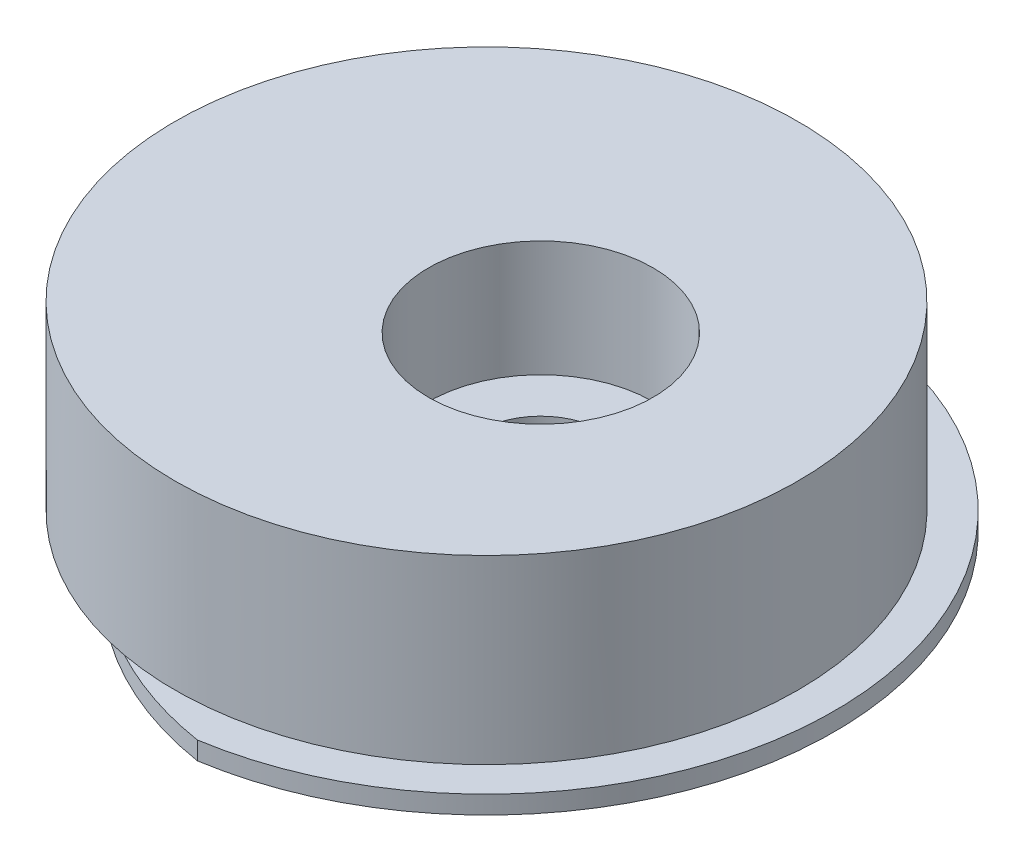
from build123d import *

# Parameters (mm, degrees)
BOSS_EXTRUDE1_DEPTH = 0.5
SKETCH2_R           = 8.6
BOSS_EXTRUDE2_DEPTH = 5
SKETCH3_R           = 1.65
SKETCH3_R_2         = 1.35
CUT_EXTRUDE1_DEPTH  = 4
SKETCH4_R           = 1.7
CUT_EXTRUDE2_DEPTH  = 15.90536816
SKETCH5_R           = 3.1
CUT_EXTRUDE3_DEPTH  = 3.2


with BuildPart() as part:
    # Sketch1 → Boss-Extrude1 (new body)
    with BuildSketch(Plane(origin=(0, 0, 0), x_dir=(1, 0, 0), z_dir=(0, 1, 0))):
        with BuildLine():
            ThreePointArc((8.1, 0), (5.799315036, 6.235382907), (0, 9.482088378))
            ThreePointArc((0, 9.482088378), (-8.1, 0), (0, -9.482088378))
            ThreePointArc((0, -9.482088378), (5.799315036, -6.235382907), (8.1, 0))
        make_face()
    extrude(amount=BOSS_EXTRUDE1_DEPTH)

    # Sketch2 → Boss-Extrude2 (add)
    with BuildSketch(Plane(origin=(0, 0.5, 0), x_dir=(1, 0, 0), z_dir=(0, 1, 0))):
        with Locations((-1.5, 0)):
            Circle(SKETCH2_R)
    extrude(amount=BOSS_EXTRUDE2_DEPTH)

    # Sketch3 → Cut-Extrude1 (cut)
    with BuildSketch(Plane(origin=(0, 0, 0), x_dir=(1, 0, 0), z_dir=(0, 1, 0))):
        with Locations((0, 5.8)):
            Circle(SKETCH3_R)
        with Locations((0, -5.8)):
            Circle(SKETCH3_R_2)
    extrude(amount=CUT_EXTRUDE1_DEPTH, mode=Mode.SUBTRACT)

    # Sketch4 → Cut-Extrude2 (cut, through all)
    with BuildSketch(Plane(origin=(0, 5.5, 0), x_dir=(1, 0, 0), z_dir=(0, 1, 0))):
        Circle(SKETCH4_R)
    extrude(amount=-CUT_EXTRUDE2_DEPTH, mode=Mode.SUBTRACT)

    # Sketch5 → Cut-Extrude3 (cut)
    with BuildSketch(Plane(origin=(0, 5.5, 0), x_dir=(1, 0, 0), z_dir=(0, 1, 0))):
        Circle(SKETCH5_R)
    extrude(amount=-CUT_EXTRUDE3_DEPTH, mode=Mode.SUBTRACT)


solid = part.part
